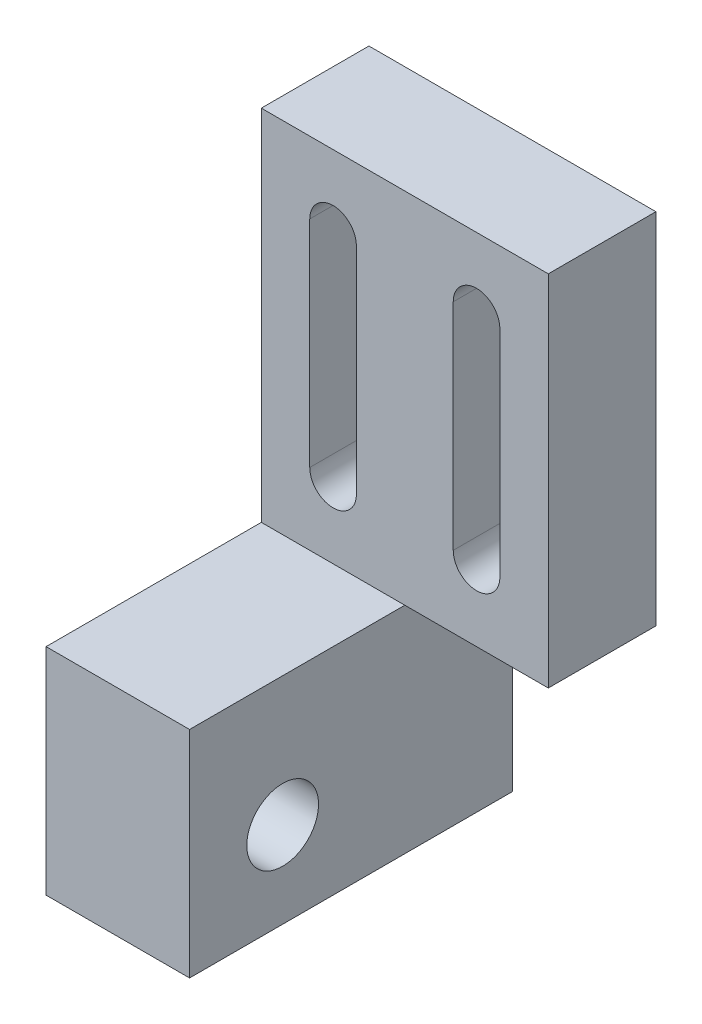
from build123d import *

# Parameters (mm, degrees)
SKETCH_1_W          = 4
SKETCH_1_H          = 6
EXTRUDE_1_DEPTH     = 9
SKETCH_5_W          = 8
SKETCH_5_H          = 10
EXTRUDE_3_DEPTH     = 3
CUT_EXTRUDE_4_DEPTH = 21.402472889
CUT_EXTRUDE_5_DEPTH = 87.357712452


with BuildPart() as part:
    # 草图1 → 凸台-拉伸1 (new body)
    with BuildSketch(Plane.XY):
        with Locations((-82.56, 3.47)):
            Rectangle(SKETCH_1_W, SKETCH_1_H)
    extrude(amount=EXTRUDE_1_DEPTH)

    # 草图5 → 凸台-拉伸3 (add)
    with BuildSketch(Plane.XY):
        with Locations((-80.56, 11.47)):
            Rectangle(SKETCH_5_W, SKETCH_5_H)
    extrude(amount=EXTRUDE_3_DEPTH)

    # 草图7 → 切除-拉伸4 (cut, through all)
    with BuildSketch(Plane.ZY.offset(84.56)):
        with BuildLine():
            ThreePointArc((7.055, 3.629934208), (6.405, 3.87), (5.755, 3.629934208))
            ThreePointArc((5.755, 3.629934208), (5.986669987, 1.961704894), (7.405, 2.87))
            ThreePointArc((7.405, 2.87), (7.313295106, 3.288330013), (7.055, 3.629934208))
        make_face()
    extrude(amount=-CUT_EXTRUDE_4_DEPTH, mode=Mode.SUBTRACT)

    # 草图8 → 切除-拉伸5 (cut, through all)
    with BuildSketch(Plane.XY.offset(3)):
        with BuildLine():
            Line((-83.21, 8.47), (-83.21, 14.47))
            ThreePointArc((-83.21, 14.47), (-82.56, 15.12), (-81.91, 14.47))
            Line((-81.91, 14.47), (-81.91, 8.47))
            ThreePointArc((-81.91, 8.47), (-82.56, 7.82), (-83.21, 8.47))
        make_face()
        with BuildLine():
            Line((-77.91, 14.47), (-77.91, 8.47))
            ThreePointArc((-77.91, 8.47), (-78.56, 7.82), (-79.21, 8.47))
            Line((-79.21, 8.47), (-79.21, 14.47))
            ThreePointArc((-79.21, 14.47), (-78.56, 15.12), (-77.91, 14.47))
        make_face()
    extrude(amount=-CUT_EXTRUDE_5_DEPTH, mode=Mode.SUBTRACT)


solid = part.part
